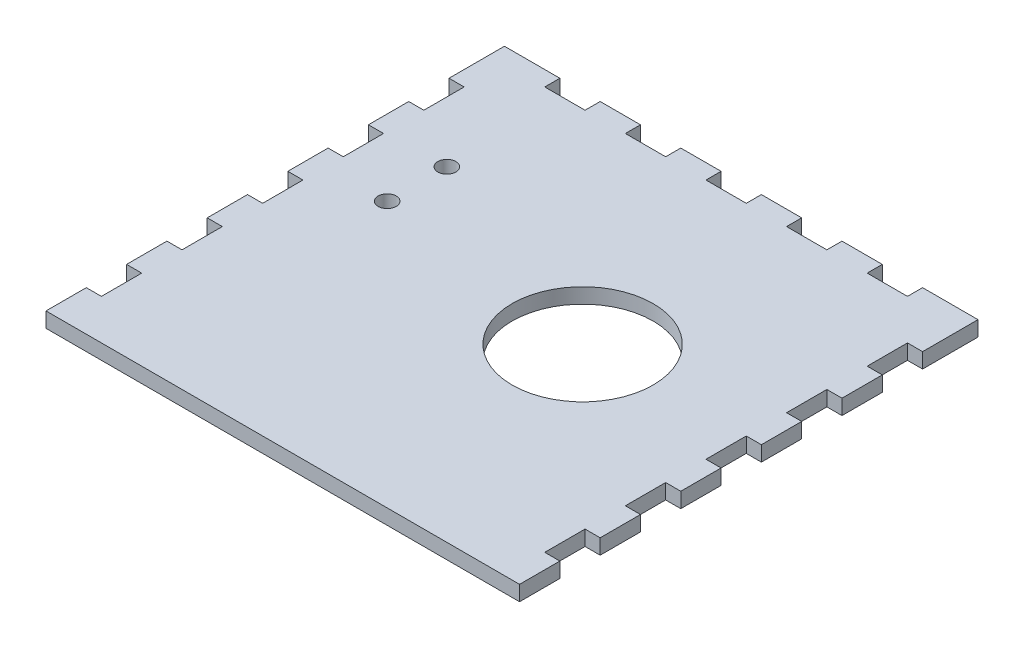
from build123d import *

# Parameters (mm, degrees)
SKETCH1_W               = 279.4
SKETCH1_H               = 279.4
BOSS_EXTRUDE1_DEPTH     = 9.525
SKETCH2_W               = 25.4
SKETCH2_H               = 9.525
BOSS_EXTRUDE2_DEPTH     = 9.525
LPATTERN1_COUNT         = 6
LPATTERN1_PITCH         = 50.8
MIRROR1_COPY_1_SKETCH_W = 25.4
MIRROR1_COPY_1_SKETCH_H = 9.525
MIRROR1_COPY_1_DEPTH    = 9.525
MIRROR1_COPY_2_SKETCH_W = 25.4
MIRROR1_COPY_2_SKETCH_H = 9.525
MIRROR1_COPY_2_DEPTH    = 9.525
MIRROR1_COPY_3_SKETCH_W = 25.4
MIRROR1_COPY_3_SKETCH_H = 9.525
MIRROR1_COPY_3_DEPTH    = 9.525
MIRROR1_COPY_4_SKETCH_W = 25.4
MIRROR1_COPY_4_SKETCH_H = 9.525
MIRROR1_COPY_4_DEPTH    = 9.525
MIRROR1_COPY_5_SKETCH_W = 25.4
MIRROR1_COPY_5_SKETCH_H = 9.525
MIRROR1_COPY_5_DEPTH    = 9.525
MIRROR1_COPY_6_SKETCH_W = 25.4
MIRROR1_COPY_6_SKETCH_H = 9.525
MIRROR1_COPY_6_DEPTH    = 9.525
SKETCH3_W               = 25.4
SKETCH3_H               = 9.525
BOSS_EXTRUDE3_DEPTH     = 9.525
LPATTERN2_COUNT         = 6
LPATTERN2_PITCH         = 50.8
SKETCH5_W               = 9.525
SKETCH5_H               = 9.525
BOSS_EXTRUDE4_DEPTH     = 9.525
SKETCH6_R               = 44.45
CUT_EXTRUDE1_DEPTH      = 212.250862424
SKETCH7_R               = 5.715
CUT_EXTRUDE2_DEPTH      = 212.250862424


with BuildPart() as part:
    # Sketch1 → Boss-Extrude1 (new body)
    with BuildSketch(Plane(origin=(0, 0, 0), x_dir=(1, 0, 0), z_dir=(0, 1, 0))):
        Rectangle(SKETCH1_W, SKETCH1_H)
    extrude(amount=BOSS_EXTRUDE1_DEPTH)

    # Sketch2 → Boss-Extrude2 (add)
    with BuildSketch(Plane(origin=(139.7, 0, 0), x_dir=(0, 0, -1), z_dir=(1, 0, 0))):
        with Locations((-127, 4.7625)):
            Rectangle(SKETCH2_W, SKETCH2_H)
    boss_extrude2 = extrude(amount=BOSS_EXTRUDE2_DEPTH)

    # LPattern1: Boss-Extrude2 ×6
    with Locations(*[(0, 0, -i * LPATTERN1_PITCH) for i in range(1, LPATTERN1_COUNT)]):
        add(boss_extrude2)

    # Mirror1 copy 1 sketch → Mirror1 copy 1 (add)
    with BuildSketch(Plane(origin=(-139.7, 0, -50.8), x_dir=(0, 0, -1), z_dir=(-1, 0, 0))):
        with Locations((-127, -4.7625)):
            Rectangle(MIRROR1_COPY_1_SKETCH_W, MIRROR1_COPY_1_SKETCH_H)
    extrude(amount=MIRROR1_COPY_1_DEPTH)

    # Mirror1 copy 2 sketch → Mirror1 copy 2 (add)
    with BuildSketch(Plane(origin=(-139.7, 0, -101.6), x_dir=(0, 0, -1), z_dir=(-1, 0, 0))):
        with Locations((-127, -4.7625)):
            Rectangle(MIRROR1_COPY_2_SKETCH_W, MIRROR1_COPY_2_SKETCH_H)
    extrude(amount=MIRROR1_COPY_2_DEPTH)

    # Mirror1 copy 3 sketch → Mirror1 copy 3 (add)
    with BuildSketch(Plane(origin=(-139.7, 0, -152.4), x_dir=(0, 0, -1), z_dir=(-1, 0, 0))):
        with Locations((-127, -4.7625)):
            Rectangle(MIRROR1_COPY_3_SKETCH_W, MIRROR1_COPY_3_SKETCH_H)
    extrude(amount=MIRROR1_COPY_3_DEPTH)

    # Mirror1 copy 4 sketch → Mirror1 copy 4 (add)
    with BuildSketch(Plane(origin=(-139.7, 0, -203.2), x_dir=(0, 0, -1), z_dir=(-1, 0, 0))):
        with Locations((-127, -4.7625)):
            Rectangle(MIRROR1_COPY_4_SKETCH_W, MIRROR1_COPY_4_SKETCH_H)
    extrude(amount=MIRROR1_COPY_4_DEPTH)

    # Mirror1 copy 5 sketch → Mirror1 copy 5 (add)
    with BuildSketch(Plane(origin=(-139.7, 0, -254), x_dir=(0, 0, -1), z_dir=(-1, 0, 0))):
        with Locations((-127, -4.7625)):
            Rectangle(MIRROR1_COPY_5_SKETCH_W, MIRROR1_COPY_5_SKETCH_H)
    extrude(amount=MIRROR1_COPY_5_DEPTH)

    # Mirror1 copy 6 sketch → Mirror1 copy 6 (add)
    with BuildSketch(Plane(origin=(-139.7, 0, 0), x_dir=(0, 0, -1), z_dir=(-1, 0, 0))):
        with Locations((-127, -4.7625)):
            Rectangle(MIRROR1_COPY_6_SKETCH_W, MIRROR1_COPY_6_SKETCH_H)
    extrude(amount=MIRROR1_COPY_6_DEPTH)

    # Sketch3 → Boss-Extrude3 (add)
    with BuildSketch(Plane(origin=(0, 0, -139.7), x_dir=(-1, 0, 0), z_dir=(0, 0, -1))):
        with Locations((-127, 4.7625)):
            Rectangle(SKETCH3_W, SKETCH3_H)
    boss_extrude3 = extrude(amount=BOSS_EXTRUDE3_DEPTH)

    # LPattern2: Boss-Extrude3 ×6
    with Locations(*[(-i * LPATTERN2_PITCH, 0, 0) for i in range(1, LPATTERN2_COUNT)]):
        add(boss_extrude3)

    # Sketch5 → Boss-Extrude4 (add)
    with BuildSketch(Plane(origin=(0, 0, -139.7), x_dir=(-1, 0, 0), z_dir=(0, 0, -1))):
        with Locations((-144.4625, 4.7625)):
            Rectangle(SKETCH5_W, SKETCH5_H)
    boss_extrude4 = extrude(amount=BOSS_EXTRUDE4_DEPTH)

    # Mirror2: Boss-Extrude4 across plane
    add(boss_extrude4.mirror(Plane(origin=(0, 0, 0), x_dir=(0, 0, 1), z_dir=(1, 0, 0))))

    # Sketch6 → Cut-Extrude1 (cut, through all)
    with BuildSketch(Plane(origin=(0, 9.525, 0), x_dir=(1, 0, 0), z_dir=(0, 1, 0))):
        with Locations((38.1, 11.176)):
            Circle(SKETCH6_R)
    extrude(amount=-CUT_EXTRUDE1_DEPTH, mode=Mode.SUBTRACT)

    # Sketch7 → Cut-Extrude2 (cut, through all)
    with BuildSketch(Plane(origin=(0, 9.525, 0), x_dir=(1, 0, 0), z_dir=(0, 1, 0))):
        with Locations((-101.6, 65.278)):
            Circle(SKETCH7_R)
        with Locations((-101.6, 27.686)):
            Circle(SKETCH7_R)
    extrude(amount=-CUT_EXTRUDE2_DEPTH, mode=Mode.SUBTRACT)


solid = part.part
